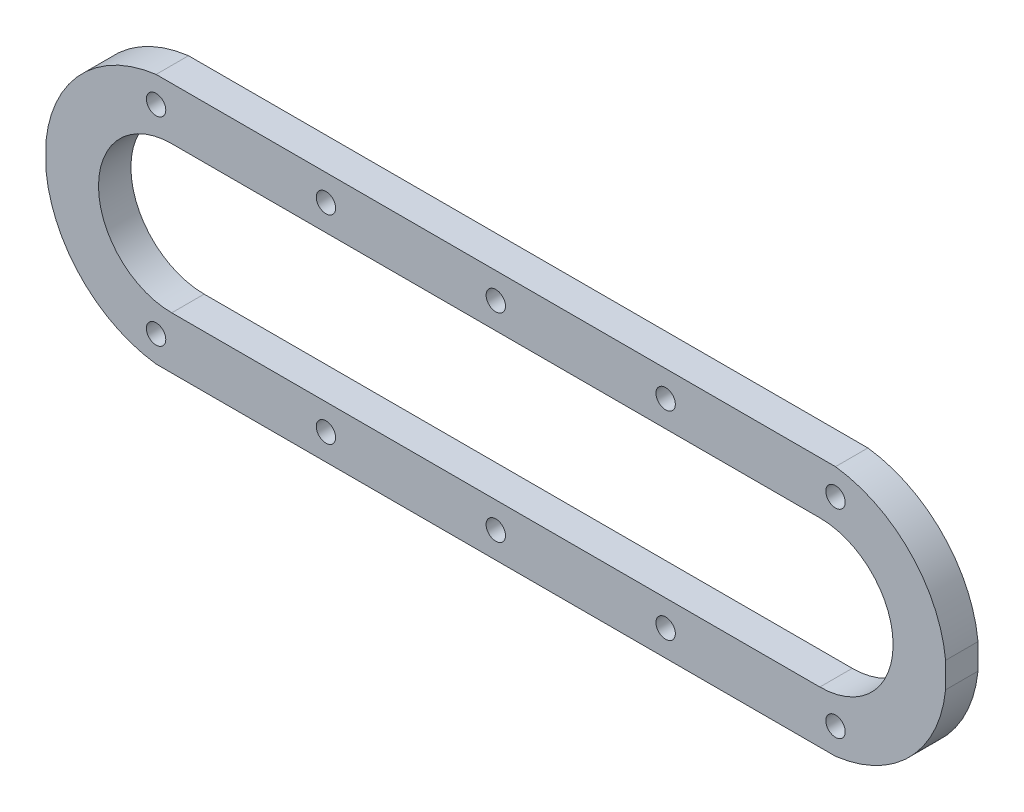
from build123d import *

# Parameters (mm, degrees)
SKETCH1_W              = 176.276
SKETCH1_H              = 49.149
BOSS_EXTRUDE1_DEPTH    = 6.35
CUT_EXTRUDE1_DEPTH     = 92.719875677
CUT_EXTRUDE4_DEPTH     = 92.719875677
F_10_24_TAPPED_HOLE1_D = 3.7973


with BuildPart() as part:
    # Sketch1 → Boss-Extrude1 (new body)
    with BuildSketch(Plane.XY):
        Rectangle(SKETCH1_W, SKETCH1_H)
    extrude(amount=BOSS_EXTRUDE1_DEPTH)

    # Sketch2 → Cut-Extrude1 (cut, through all)
    with BuildSketch(Plane.XY.offset(6.35)):
        with BuildLine():
            Line((63.5, -14.351), (-63.5, -14.351))
            ThreePointArc((-63.5, -14.351), (-77.851, 0), (-63.5, 14.351))
            Line((-63.5, 14.351), (63.5, 14.351))
            ThreePointArc((63.5, 14.351), (77.851, 0), (63.5, -14.351))
        make_face()
    extrude(amount=-CUT_EXTRUDE1_DEPTH, mode=Mode.SUBTRACT)

    # Sketch8 → Cut-Extrude4 (cut, through all)
    with BuildSketch(Plane.XY.offset(6.35)):
        with BuildLine():
            ThreePointArc((-88.138, 2.504831531), (-81.209963357, 17.310760321), (-66.565807357, 24.5745))
            Line((-66.565807357, 24.5745), (-88.138, 24.5745))
            Line((-88.138, 24.5745), (-88.138, 2.504831531))
        make_face()
        with BuildLine():
            Line((88.138, 24.5745), (66.565807357, 24.5745))
            ThreePointArc((66.565807357, 24.5745), (81.209963357, 17.310760321), (88.138, 2.504831531))
            Line((88.138, 2.504831531), (88.138, 24.5745))
        make_face()
        with BuildLine():
            ThreePointArc((-66.565807357, -24.5745), (-81.209963357, -17.310760321), (-88.138, -2.504831531))
            Line((-88.138, -2.504831531), (-88.138, -24.5745))
            Line((-88.138, -24.5745), (-66.565807357, -24.5745))
        make_face()
        with BuildLine():
            Line((88.138, -24.5745), (88.138, -2.504831531))
            ThreePointArc((88.138, -2.504831531), (81.209963357, -17.310760321), (66.565807357, -24.5745))
            Line((66.565807357, -24.5745), (88.138, -24.5745))
        make_face()
    extrude(amount=-CUT_EXTRUDE4_DEPTH, mode=Mode.SUBTRACT)

    # #10-24 Tapped Hole1 (through all)
    with Locations(Plane.XY.offset(6.35)):
        with Locations((-66.565807357, 19.46275), (-33.282903678, 19.46275), (0, 19.46275), (33.282903678, 19.46275), (66.565807357, 19.46275), (66.565807357, -19.46275), (33.282903678, -19.46275), (0, -19.46275), (-33.282903678, -19.46275), (-66.565807357, -19.46275)):
            Hole(F_10_24_TAPPED_HOLE1_D / 2)


solid = part.part
